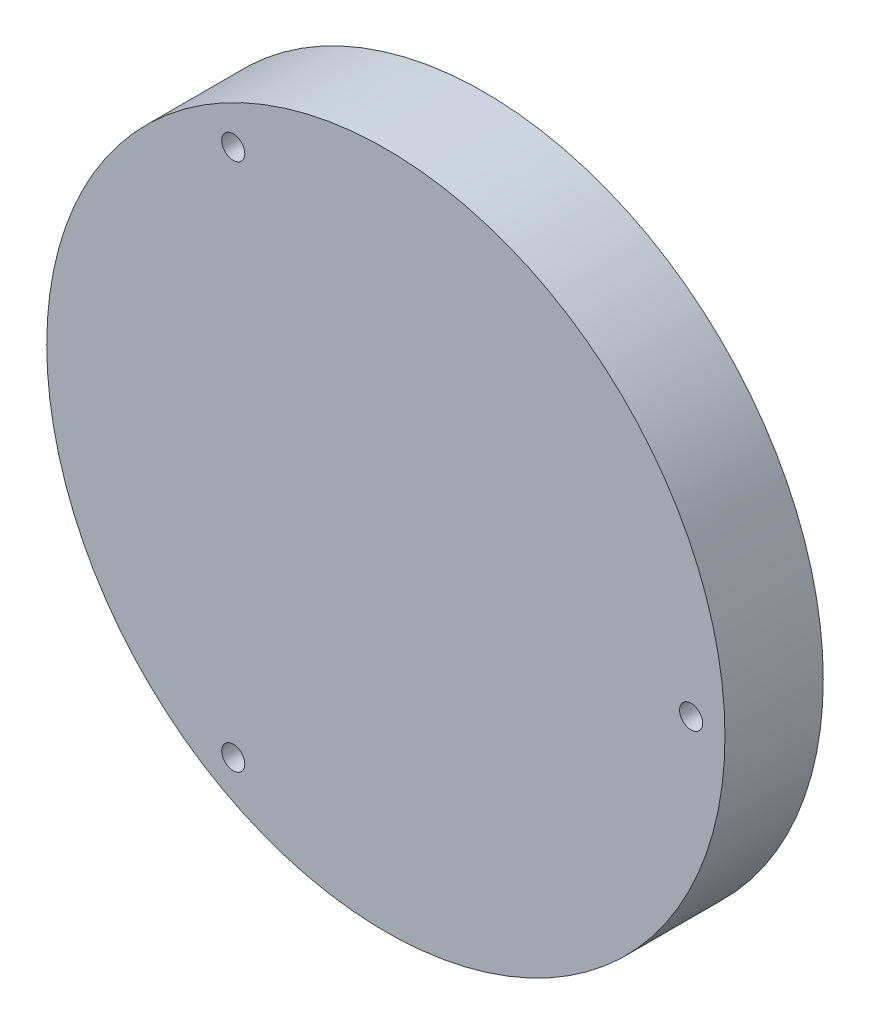
from build123d import *

# Parameters (mm, degrees)
SKETCH2_R           = 50
SKETCH2_R_2         = 1.7
BOSS_EXTRUDE1_DEPTH = 14.488631768


with BuildPart() as part:
    # Sketch2 → Boss-Extrude1 (new body)
    with BuildSketch(Plane(origin=(0, 0, 0), x_dir=(0, 1, 0), z_dir=(0, 0, 1))):
        Circle(SKETCH2_R)
        with Locations((0, -45)):
            Circle(SKETCH2_R_2, mode=Mode.SUBTRACT)
        with Locations((-38.97114317, 22.5)):
            Circle(SKETCH2_R_2, mode=Mode.SUBTRACT)
        with Locations((38.97114317, 22.5)):
            Circle(SKETCH2_R_2, mode=Mode.SUBTRACT)
    extrude(amount=BOSS_EXTRUDE1_DEPTH)


solid = part.part
